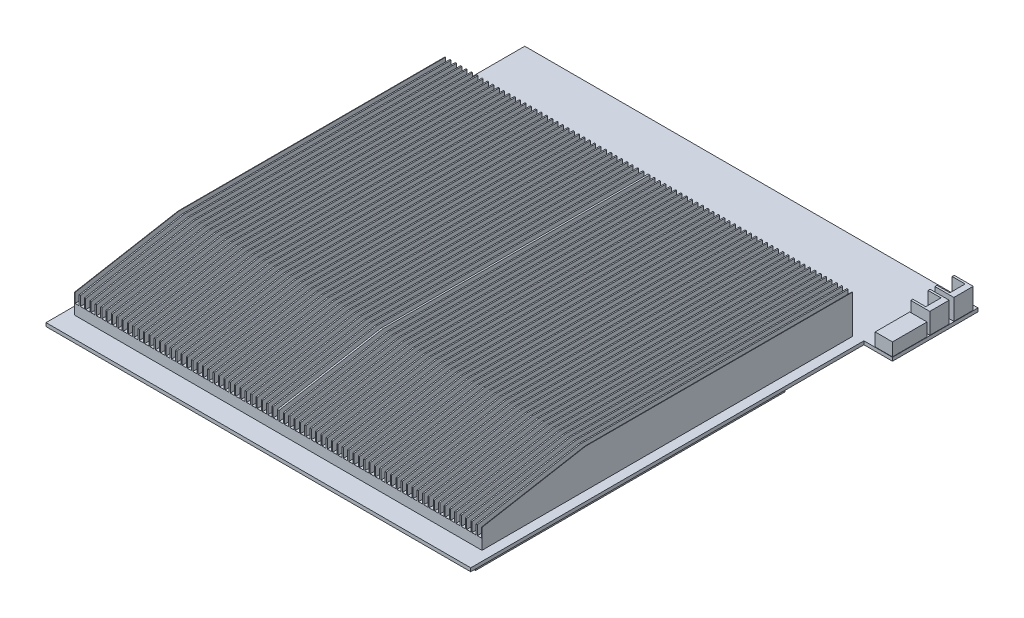
from build123d import *

# Parameters (mm, degrees)
BOSS_EXTRUDE1_DEPTH   = 2
SKETCH2_W             = 235.75
SKETCH2_H             = 214.5
BOSS_EXTRUDE2_DEPTH   = 22.2
CUT_EXTRUDE1_DEPTH    = 235.75
SKETCH5_W             = 27.3
SKETCH5_H             = 30.25
BOSS_EXTRUDE4_DEPTH   = 12.75
SKETCH6_W             = 2.4
SKETCH6_H             = 16.2
CUT_EXTRUDE2_DEPTH    = 348.365733054
SKETCH7_W             = 2.4
SKETCH7_H             = 10.810120739
CUT_EXTRUDE3_DEPTH    = 372.666201046
SKETCH8_W             = 10
SKETCH8_H             = 20
BOSS_EXTRUDE5_DEPTH   = 7.5
BOSS_EXTRUDE6_DEPTH   = 12
BOSS_EXTRUDE6_2_DEPTH = 12


with BuildPart() as part:
    # Sketch1 → Boss-Extrude1 (new body)
    with BuildSketch(Plane(origin=(0, 0, 0), x_dir=(1, 0, 0), z_dir=(0, 1, 0))):
        Polygon((0, 0), (0, 277), (262.25, 277), (262.25, 227.5), (245.75, 227.5), (245.75, 0), align=None)
    extrude(amount=BOSS_EXTRUDE1_DEPTH)

    # Sketch2 → Boss-Extrude2 (add)
    with BuildSketch(Plane(origin=(0, 2, 0), x_dir=(1, 0, 0), z_dir=(0, 1, 0))):
        with Locations((122.375, 119.25)):
            Rectangle(SKETCH2_W, SKETCH2_H)
    extrude(amount=BOSS_EXTRUDE2_DEPTH)

    # Sketch3 → Cut-Extrude1 (cut)
    with BuildSketch(Plane(origin=(240.25, 0, 0), x_dir=(0, 0, -1), z_dir=(1, 0, 0))):
        Polygon((12, 13.5), (72, 24.2), (12, 24.2), align=None)
    extrude(amount=-CUT_EXTRUDE1_DEPTH, mode=Mode.SUBTRACT)

    # Sketch5 → Boss-Extrude4 (add)
    with BuildSketch(Plane.XZ):
        Polygon((7.969075183, -193.75), (7.969075183, -14.75), (233.75849879, -14.75), (233.75849879, -193.75), (174.25849879, -193.75), (174.25849879, -226.5), (67.469075183, -226.5), (67.469075183, -193.75), align=None)
        with Locations((136.200813534, -256.375)):
            Rectangle(SKETCH5_W, SKETCH5_H)
    extrude(amount=BOSS_EXTRUDE4_DEPTH)

    # Sketch6 → Cut-Extrude2 (cut, through all)
    with BuildSketch(Plane(origin=(0, 0, -226.5), x_dir=(-1, 0, 0), z_dir=(0, 0, -1))):
        with Locations((-124.075, 16.1)):
            Rectangle(SKETCH6_W, SKETCH6_H)
        with Locations((-120.675, 16.1)):
            Rectangle(SKETCH6_W, SKETCH6_H)
        with Locations((-127.175, 16.1)):
            Rectangle(SKETCH6_W, SKETCH6_H)
        with Locations((-130.275, 16.1)):
            Rectangle(SKETCH6_W, SKETCH6_H)
        with Locations((-133.375, 16.1)):
            Rectangle(SKETCH6_W, SKETCH6_H)
        with Locations((-136.475, 16.1)):
            Rectangle(SKETCH6_W, SKETCH6_H)
        with Locations((-139.575, 16.1)):
            Rectangle(SKETCH6_W, SKETCH6_H)
        with Locations((-142.675, 16.1)):
            Rectangle(SKETCH6_W, SKETCH6_H)
        with Locations((-145.775, 16.1)):
            Rectangle(SKETCH6_W, SKETCH6_H)
        with Locations((-148.875, 16.1)):
            Rectangle(SKETCH6_W, SKETCH6_H)
        with Locations((-151.975, 16.1)):
            Rectangle(SKETCH6_W, SKETCH6_H)
        with Locations((-155.075, 16.1)):
            Rectangle(SKETCH6_W, SKETCH6_H)
        with Locations((-158.175, 16.1)):
            Rectangle(SKETCH6_W, SKETCH6_H)
        with Locations((-161.275, 16.1)):
            Rectangle(SKETCH6_W, SKETCH6_H)
        with Locations((-164.375, 16.1)):
            Rectangle(SKETCH6_W, SKETCH6_H)
        with Locations((-167.475, 16.1)):
            Rectangle(SKETCH6_W, SKETCH6_H)
        with Locations((-170.575, 16.1)):
            Rectangle(SKETCH6_W, SKETCH6_H)
        with Locations((-173.675, 16.1)):
            Rectangle(SKETCH6_W, SKETCH6_H)
        with Locations((-176.775, 16.1)):
            Rectangle(SKETCH6_W, SKETCH6_H)
        with Locations((-179.875, 16.1)):
            Rectangle(SKETCH6_W, SKETCH6_H)
        with Locations((-182.975, 16.1)):
            Rectangle(SKETCH6_W, SKETCH6_H)
        with Locations((-186.075, 16.1)):
            Rectangle(SKETCH6_W, SKETCH6_H)
        with Locations((-189.175, 16.1)):
            Rectangle(SKETCH6_W, SKETCH6_H)
        with Locations((-192.275, 16.1)):
            Rectangle(SKETCH6_W, SKETCH6_H)
        with Locations((-195.375, 16.1)):
            Rectangle(SKETCH6_W, SKETCH6_H)
        with Locations((-198.475, 16.1)):
            Rectangle(SKETCH6_W, SKETCH6_H)
        with Locations((-201.575, 16.1)):
            Rectangle(SKETCH6_W, SKETCH6_H)
        with Locations((-204.675, 16.1)):
            Rectangle(SKETCH6_W, SKETCH6_H)
        with Locations((-207.775, 16.1)):
            Rectangle(SKETCH6_W, SKETCH6_H)
        with Locations((-210.875, 16.1)):
            Rectangle(SKETCH6_W, SKETCH6_H)
        with Locations((-213.975, 16.1)):
            Rectangle(SKETCH6_W, SKETCH6_H)
        with Locations((-217.075, 16.1)):
            Rectangle(SKETCH6_W, SKETCH6_H)
        with Locations((-220.175, 16.1)):
            Rectangle(SKETCH6_W, SKETCH6_H)
        with Locations((-223.275, 16.1)):
            Rectangle(SKETCH6_W, SKETCH6_H)
        with Locations((-226.375, 16.1)):
            Rectangle(SKETCH6_W, SKETCH6_H)
        with Locations((-229.475, 16.1)):
            Rectangle(SKETCH6_W, SKETCH6_H)
        with Locations((-232.575, 16.1)):
            Rectangle(SKETCH6_W, SKETCH6_H)
        with Locations((-235.675, 16.1)):
            Rectangle(SKETCH6_W, SKETCH6_H)
        with Locations((-238.775, 16.1)):
            Rectangle(SKETCH6_W, SKETCH6_H)
        with Locations((-117.575, 16.1)):
            Rectangle(SKETCH6_W, SKETCH6_H)
        with Locations((-114.475, 16.1)):
            Rectangle(SKETCH6_W, SKETCH6_H)
        with Locations((-111.375, 16.1)):
            Rectangle(SKETCH6_W, SKETCH6_H)
        with Locations((-108.275, 16.1)):
            Rectangle(SKETCH6_W, SKETCH6_H)
        with Locations((-105.175, 16.1)):
            Rectangle(SKETCH6_W, SKETCH6_H)
        with Locations((-102.075, 16.1)):
            Rectangle(SKETCH6_W, SKETCH6_H)
        with Locations((-98.975, 16.1)):
            Rectangle(SKETCH6_W, SKETCH6_H)
        with Locations((-95.875, 16.1)):
            Rectangle(SKETCH6_W, SKETCH6_H)
        with Locations((-92.775, 16.1)):
            Rectangle(SKETCH6_W, SKETCH6_H)
        with Locations((-89.675, 16.1)):
            Rectangle(SKETCH6_W, SKETCH6_H)
        with Locations((-86.575, 16.1)):
            Rectangle(SKETCH6_W, SKETCH6_H)
        with Locations((-83.475, 16.1)):
            Rectangle(SKETCH6_W, SKETCH6_H)
        with Locations((-80.375, 16.1)):
            Rectangle(SKETCH6_W, SKETCH6_H)
        with Locations((-77.275, 16.1)):
            Rectangle(SKETCH6_W, SKETCH6_H)
        with Locations((-74.175, 16.1)):
            Rectangle(SKETCH6_W, SKETCH6_H)
        with Locations((-71.075, 16.1)):
            Rectangle(SKETCH6_W, SKETCH6_H)
        with Locations((-67.975, 16.1)):
            Rectangle(SKETCH6_W, SKETCH6_H)
        with Locations((-64.875, 16.1)):
            Rectangle(SKETCH6_W, SKETCH6_H)
        with Locations((-61.775, 16.1)):
            Rectangle(SKETCH6_W, SKETCH6_H)
        with Locations((-58.675, 16.1)):
            Rectangle(SKETCH6_W, SKETCH6_H)
        with Locations((-55.575, 16.1)):
            Rectangle(SKETCH6_W, SKETCH6_H)
        with Locations((-52.475, 16.1)):
            Rectangle(SKETCH6_W, SKETCH6_H)
        with Locations((-49.375, 16.1)):
            Rectangle(SKETCH6_W, SKETCH6_H)
        with Locations((-46.275, 16.1)):
            Rectangle(SKETCH6_W, SKETCH6_H)
        with Locations((-43.175, 16.1)):
            Rectangle(SKETCH6_W, SKETCH6_H)
        with Locations((-40.075, 16.1)):
            Rectangle(SKETCH6_W, SKETCH6_H)
        with Locations((-36.975, 16.1)):
            Rectangle(SKETCH6_W, SKETCH6_H)
        with Locations((-33.875, 16.1)):
            Rectangle(SKETCH6_W, SKETCH6_H)
        with Locations((-30.775, 16.1)):
            Rectangle(SKETCH6_W, SKETCH6_H)
        with Locations((-27.675, 16.1)):
            Rectangle(SKETCH6_W, SKETCH6_H)
        with Locations((-24.575, 16.1)):
            Rectangle(SKETCH6_W, SKETCH6_H)
        with Locations((-21.475, 16.1)):
            Rectangle(SKETCH6_W, SKETCH6_H)
        with Locations((-18.375, 16.1)):
            Rectangle(SKETCH6_W, SKETCH6_H)
        with Locations((-15.275, 16.1)):
            Rectangle(SKETCH6_W, SKETCH6_H)
        with Locations((-12.175, 16.1)):
            Rectangle(SKETCH6_W, SKETCH6_H)
        with Locations((-9.075, 16.1)):
            Rectangle(SKETCH6_W, SKETCH6_H)
        with Locations((-5.975, 16.1)):
            Rectangle(SKETCH6_W, SKETCH6_H)
    extrude(amount=-CUT_EXTRUDE2_DEPTH, mode=Mode.SUBTRACT)

    # Sketch7 → Cut-Extrude3 (cut, through all)
    with BuildSketch(Plane.XY.offset(-14.75)):
        with Locations((118.663786987, -7.34493963)):
            Rectangle(SKETCH7_W, SKETCH7_H)
        with Locations((123.063786987, -7.34493963)):
            Rectangle(SKETCH7_W, SKETCH7_H)
        with Locations((126.163786987, -7.34493963)):
            Rectangle(SKETCH7_W, SKETCH7_H)
        with Locations((129.263786987, -7.34493963)):
            Rectangle(SKETCH7_W, SKETCH7_H)
        with Locations((132.363786987, -7.34493963)):
            Rectangle(SKETCH7_W, SKETCH7_H)
        with Locations((135.463786987, -7.34493963)):
            Rectangle(SKETCH7_W, SKETCH7_H)
        with Locations((138.563786987, -7.34493963)):
            Rectangle(SKETCH7_W, SKETCH7_H)
        with Locations((141.663786987, -7.34493963)):
            Rectangle(SKETCH7_W, SKETCH7_H)
        with Locations((144.763786987, -7.34493963)):
            Rectangle(SKETCH7_W, SKETCH7_H)
        with Locations((147.863786987, -7.34493963)):
            Rectangle(SKETCH7_W, SKETCH7_H)
        with Locations((150.963786987, -7.34493963)):
            Rectangle(SKETCH7_W, SKETCH7_H)
        with Locations((154.063786987, -7.34493963)):
            Rectangle(SKETCH7_W, SKETCH7_H)
        with Locations((157.163786987, -7.34493963)):
            Rectangle(SKETCH7_W, SKETCH7_H)
        with Locations((160.263786987, -7.34493963)):
            Rectangle(SKETCH7_W, SKETCH7_H)
        with Locations((163.363786987, -7.34493963)):
            Rectangle(SKETCH7_W, SKETCH7_H)
        with Locations((166.463786987, -7.34493963)):
            Rectangle(SKETCH7_W, SKETCH7_H)
        with Locations((169.563786987, -7.34493963)):
            Rectangle(SKETCH7_W, SKETCH7_H)
        with Locations((172.663786987, -7.34493963)):
            Rectangle(SKETCH7_W, SKETCH7_H)
        with Locations((175.763786987, -7.34493963)):
            Rectangle(SKETCH7_W, SKETCH7_H)
        with Locations((178.863786987, -7.34493963)):
            Rectangle(SKETCH7_W, SKETCH7_H)
        with Locations((181.963786987, -7.34493963)):
            Rectangle(SKETCH7_W, SKETCH7_H)
        with Locations((185.063786987, -7.34493963)):
            Rectangle(SKETCH7_W, SKETCH7_H)
        with Locations((188.163786987, -7.34493963)):
            Rectangle(SKETCH7_W, SKETCH7_H)
        with Locations((191.263786987, -7.34493963)):
            Rectangle(SKETCH7_W, SKETCH7_H)
        with Locations((194.363786987, -7.34493963)):
            Rectangle(SKETCH7_W, SKETCH7_H)
        with Locations((197.463786987, -7.34493963)):
            Rectangle(SKETCH7_W, SKETCH7_H)
        with Locations((200.563786987, -7.34493963)):
            Rectangle(SKETCH7_W, SKETCH7_H)
        with Locations((203.663786987, -7.34493963)):
            Rectangle(SKETCH7_W, SKETCH7_H)
        with Locations((206.763786987, -7.34493963)):
            Rectangle(SKETCH7_W, SKETCH7_H)
        with Locations((209.863786987, -7.34493963)):
            Rectangle(SKETCH7_W, SKETCH7_H)
        with Locations((212.963786987, -7.34493963)):
            Rectangle(SKETCH7_W, SKETCH7_H)
        with Locations((216.063786987, -7.34493963)):
            Rectangle(SKETCH7_W, SKETCH7_H)
        with Locations((219.163786987, -7.34493963)):
            Rectangle(SKETCH7_W, SKETCH7_H)
        with Locations((222.263786987, -7.34493963)):
            Rectangle(SKETCH7_W, SKETCH7_H)
        with Locations((225.363786987, -7.34493963)):
            Rectangle(SKETCH7_W, SKETCH7_H)
        with Locations((228.463786987, -7.34493963)):
            Rectangle(SKETCH7_W, SKETCH7_H)
        with Locations((231.563786987, -7.34493963)):
            Rectangle(SKETCH7_W, SKETCH7_H)
        with Locations((115.563786987, -7.34493963)):
            Rectangle(SKETCH7_W, SKETCH7_H)
        with Locations((112.463786987, -7.34493963)):
            Rectangle(SKETCH7_W, SKETCH7_H)
        with Locations((109.363786987, -7.34493963)):
            Rectangle(SKETCH7_W, SKETCH7_H)
        with Locations((106.263786987, -7.34493963)):
            Rectangle(SKETCH7_W, SKETCH7_H)
        with Locations((103.163786987, -7.34493963)):
            Rectangle(SKETCH7_W, SKETCH7_H)
        with Locations((100.063786987, -7.34493963)):
            Rectangle(SKETCH7_W, SKETCH7_H)
        with Locations((96.963786987, -7.34493963)):
            Rectangle(SKETCH7_W, SKETCH7_H)
        with Locations((93.863786987, -7.34493963)):
            Rectangle(SKETCH7_W, SKETCH7_H)
        with Locations((90.763786987, -7.34493963)):
            Rectangle(SKETCH7_W, SKETCH7_H)
        with Locations((87.663786987, -7.34493963)):
            Rectangle(SKETCH7_W, SKETCH7_H)
        with Locations((84.563786987, -7.34493963)):
            Rectangle(SKETCH7_W, SKETCH7_H)
        with Locations((81.463786987, -7.34493963)):
            Rectangle(SKETCH7_W, SKETCH7_H)
        with Locations((78.363786987, -7.34493963)):
            Rectangle(SKETCH7_W, SKETCH7_H)
        with Locations((75.263786987, -7.34493963)):
            Rectangle(SKETCH7_W, SKETCH7_H)
        with Locations((72.163786987, -7.34493963)):
            Rectangle(SKETCH7_W, SKETCH7_H)
        with Locations((69.063786987, -7.34493963)):
            Rectangle(SKETCH7_W, SKETCH7_H)
        with Locations((65.963786987, -7.34493963)):
            Rectangle(SKETCH7_W, SKETCH7_H)
        with Locations((62.863786987, -7.34493963)):
            Rectangle(SKETCH7_W, SKETCH7_H)
        with Locations((59.763786987, -7.34493963)):
            Rectangle(SKETCH7_W, SKETCH7_H)
        with Locations((56.663786987, -7.34493963)):
            Rectangle(SKETCH7_W, SKETCH7_H)
        with Locations((53.563786987, -7.34493963)):
            Rectangle(SKETCH7_W, SKETCH7_H)
        with Locations((50.463786987, -7.34493963)):
            Rectangle(SKETCH7_W, SKETCH7_H)
        with Locations((47.363786987, -7.34493963)):
            Rectangle(SKETCH7_W, SKETCH7_H)
        with Locations((44.263786987, -7.34493963)):
            Rectangle(SKETCH7_W, SKETCH7_H)
        with Locations((41.163786987, -7.34493963)):
            Rectangle(SKETCH7_W, SKETCH7_H)
        with Locations((38.063786987, -7.34493963)):
            Rectangle(SKETCH7_W, SKETCH7_H)
        with Locations((34.963786987, -7.34493963)):
            Rectangle(SKETCH7_W, SKETCH7_H)
        with Locations((31.863786987, -7.34493963)):
            Rectangle(SKETCH7_W, SKETCH7_H)
        with Locations((28.763786987, -7.34493963)):
            Rectangle(SKETCH7_W, SKETCH7_H)
        with Locations((25.663786987, -7.34493963)):
            Rectangle(SKETCH7_W, SKETCH7_H)
        with Locations((22.563786987, -7.34493963)):
            Rectangle(SKETCH7_W, SKETCH7_H)
        with Locations((19.463786987, -7.34493963)):
            Rectangle(SKETCH7_W, SKETCH7_H)
        with Locations((16.363786987, -7.34493963)):
            Rectangle(SKETCH7_W, SKETCH7_H)
        with Locations((13.263786987, -7.34493963)):
            Rectangle(SKETCH7_W, SKETCH7_H)
        with Locations((10.163786987, -7.34493963)):
            Rectangle(SKETCH7_W, SKETCH7_H)
    extrude(amount=-CUT_EXTRUDE3_DEPTH, mode=Mode.SUBTRACT)


with BuildPart() as body_2:
    # Sketch8 → Boss-Extrude5 (new body)
    with BuildSketch(Plane(origin=(0, 2.2, 0), x_dir=(1, 0, 0), z_dir=(0, 1, 0))):
        with Locations((257.25, 237.5)):
            Rectangle(SKETCH8_W, SKETCH8_H)
    extrude(amount=BOSS_EXTRUDE5_DEPTH)


with BuildPart() as body_3:
    # Sketch9 → Boss-Extrude6 (new body)
    with BuildSketch(Plane(origin=(0, 2.2, 0), x_dir=(1, 0, 0), z_dir=(0, 1, 0))):
        Polygon((251.25, 263.05), (262.25, 263.05), (262.25, 274.25), (251.25, 274.25), (251.25, 273.05), (258.75, 273.05), (258.75, 264.25), (251.25, 264.25), align=None)
    extrude(amount=BOSS_EXTRUDE6_DEPTH)


with BuildPart() as body_4:
    # Sketch9 → Boss-Extrude6 2 (new body)
    with BuildSketch(Plane(origin=(0, 2.2, 0), x_dir=(1, 0, 0), z_dir=(0, 1, 0))):
        Polygon((251.25, 249.1), (262.25, 249.1), (262.25, 260.3), (251.25, 260.3), (251.25, 259.1), (258.75, 259.1), (258.75, 250.3), (251.25, 250.3), align=None)
    extrude(amount=BOSS_EXTRUDE6_2_DEPTH)


solid = Compound([part.part, body_2.part, body_3.part, body_4.part])
